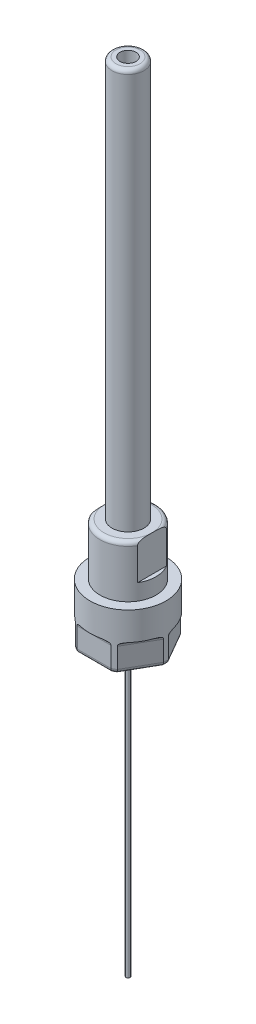
from build123d import *

# Parameters (mm, degrees)
ESQUISSE2_R             = 4
ENL_V_MAT_EXTRU_1_DEPTH = 8
ENL_V_START             = -9
ENL_V_MAT_EXTRU_2_DEPTH = 9
ESQUISSE4_R             = 15
ENL_V_MAT_EXTRU_3_DEPTH = 7
CONG_1_R                = 1
ESQUISSE5_R             = 0.5
BOSS_EXTRU_1_DEPTH      = 80


with BuildPart() as part:
    # Esquisse1 → Révolution1 (revolve)
    with BuildSketch(Plane.XY, mode=Mode.PRIVATE) as r_volution1_sk:
        Polygon((4, 127), (4, 27), (7, 27), (7, 14), (9.5, 14), (9.5, 0), (0, 0), (0, 121), (2, 123), (2, 127), align=None)
    revolve(r_volution1_sk.sketch.rotate(Axis((0, 0, 0), (0, 1, 0)), 90), axis=Axis((0, 0, 0), (0, 1, 0)))

    # Esquisse2 → Enlèv. mat.-Extru.1 (cut)
    with BuildSketch(Plane.XZ):
        with Locations(Location((0, 0, 0), (0, 0, 270))):
            Circle(ESQUISSE2_R)
    extrude(amount=-ENL_V_MAT_EXTRU_1_DEPTH, mode=Mode.SUBTRACT)

    # Esquisse3 → Enlèv. mat.-Extru.2 (cut)
    with BuildSketch(Plane(origin=(0, 27, 0), x_dir=(1, 0, 0), z_dir=(0, 1, 0)).offset(ENL_V_START)):
        with BuildLine():
            Line((6, -3.605551275), (6, 3.605551275))
            ThreePointArc((6, 3.605551275), (7, 0), (6, -3.605551275))
        make_face()
        with BuildLine():
            Line((-6, -3.605551275), (-6, 3.605551275))
            ThreePointArc((-6, 3.605551275), (-7, 0), (-6, -3.605551275))
        make_face()
    extrude(amount=ENL_V_MAT_EXTRU_2_DEPTH, mode=Mode.SUBTRACT)

    # Esquisse4 → Enlèv. mat.-Extru.3 (cut)
    with BuildSketch(Plane.XZ):
        Circle(ESQUISSE4_R)
        Polygon((9.814954576, 0), (4.907477288, 8.5), (-4.907477288, 8.5), (-9.814954576, 0), (-4.907477288, -8.5), (4.907477288, -8.5), align=None, mode=Mode.SUBTRACT)
    extrude(amount=-ENL_V_MAT_EXTRU_3_DEPTH, mode=Mode.SUBTRACT)

    # Congé1
    cong_1_edges = [part.edges().sort_by_distance(p)[0] for p in [
        (0, 127, 4),
        (-3.446820352, 27, -6.092571663),
        (0, 27, 7),
        (0, 0, -8.5),
        (-4.75, 0, -8.227241336),
        (-7.361215932, 0, -4.25),
        (-9.5, 0, 0),
        (-7.361215932, 0, 4.25),
        (-4.75, 0, 8.227241336),
        (0, 0, 8.5),
        (4.75, 0, 8.227241336),
        (7.361215932, 0, 4.25),
        (9.5, 0, 0),
        (7.361215932, 0, -4.25),
        (4.75, 0, -8.227241336),
        (0, 0, 4),
        (0, 7, 8.5),
        (7.361215932, 7, 4.25),
        (7.361215932, 7, -4.25),
        (0, 7, -8.5),
        (-7.361215932, 7, -4.25),
        (-7.361215932, 7, 4.25),
    ]]
    fillet(cong_1_edges, radius=CONG_1_R - 0.0001)  # a hair under: the kernel refuses the full size

    # Esquisse5 → Boss.-Extru.1 (add)
    with BuildSketch(Plane.XZ.offset(-8)):
        with Locations(Location((0, 0, 0), (0, 0, 270))):
            Circle(ESQUISSE5_R)
    extrude(amount=BOSS_EXTRU_1_DEPTH)


solid = part.part
